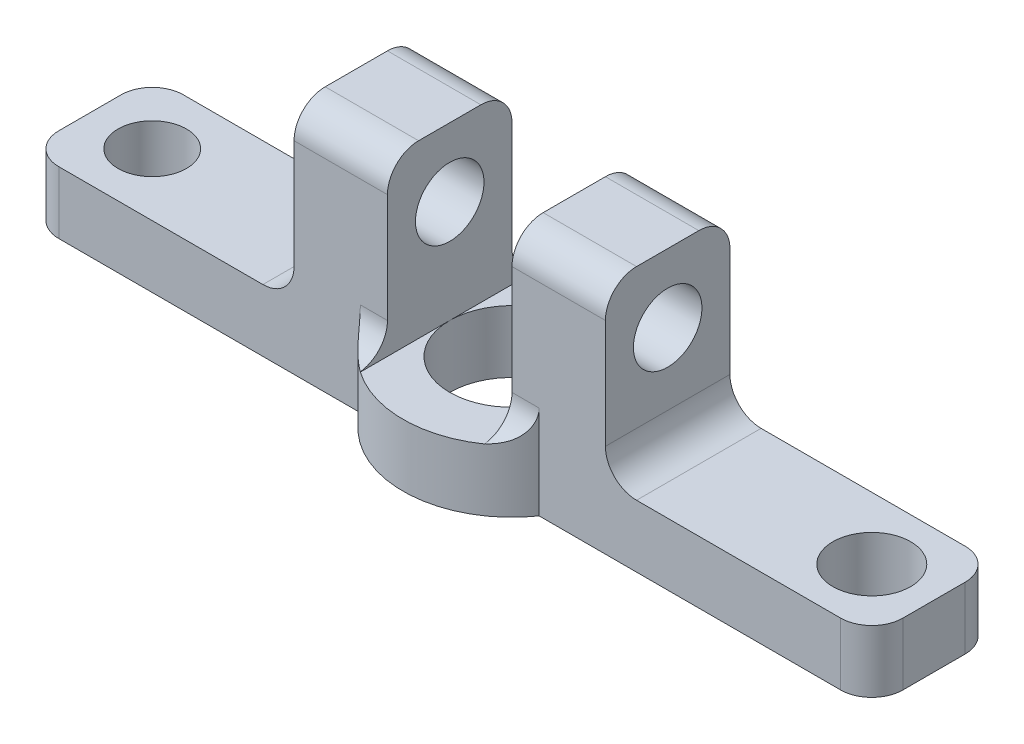
from build123d import *

# Parameters (mm, degrees)
SKETCH_1_R          = 2
SKETCH_1_R_2        = 1.25
SKETCH_1_R_3        = 1.1
EXTRUDE_1_DEPTH     = 2
SKETCH_2_W          = 3
SKETCH_2_H          = 4
EXTRUDE_2_DEPTH     = 5.5
SKETCH_4_R          = 1.1
CUT_EXTRUDE_1_DEPTH = 11
FILLET_2_R          = 1
FILLET_3_R          = 1
FILLET_4_R          = 1
FILLET_5_R          = 1


with BuildPart() as part:
    # 草图1 → 凸台-拉伸1 (new body)
    with BuildSketch(Plane(origin=(0, 0, 0), x_dir=(1, 0, 0), z_dir=(0, 1, 0))):
        with BuildLine():
            Line((6.711295009, -2), (17.394013685, -2))
            Line((17.394013685, -2), (17.394013685, 2))
            Line((17.394013685, 2), (6.711295009, 2))
            ThreePointArc((6.711295009, 2), (3.839013685, 3.5), (0.966732362, 2))
            Line((0.966732362, 2), (-9.715986315, 2))
            Line((-9.715986315, 2), (-9.715986315, -2))
            Line((-9.715986315, -2), (0.966732362, -2))
            ThreePointArc((0.966732362, -2), (3.839013685, -3.5), (6.711295009, -2))
        make_face()
        with Locations(Location((3.839013685, 0, 0), (0, 0, 270))):
            Circle(SKETCH_1_R, mode=Mode.SUBTRACT)
        with Locations(Location((15.394013685, 0, 0), (0, 0, 270))):
            Circle(SKETCH_1_R_2, mode=Mode.SUBTRACT)
        with Locations(Location((-7.715986315, 0, 0), (0, 0, 270))):
            Circle(SKETCH_1_R_3, mode=Mode.SUBTRACT)
    extrude(amount=EXTRUDE_1_DEPTH)

    # 草图2 → 凸台-拉伸2 (add)
    with BuildSketch(Plane(origin=(0, 2, 0), x_dir=(1, 0, 0), z_dir=(0, 1, 0))):
        with Locations((7.339013685, 0)):
            Rectangle(SKETCH_2_W, SKETCH_2_H)
        with Locations((0.339013685, 0)):
            Rectangle(SKETCH_2_W, SKETCH_2_H)
    extrude(amount=EXTRUDE_2_DEPTH)

    # 草图4 → 切除-拉伸1 (cut)
    with BuildSketch(Plane.ZY.offset(1.160986315)):
        with Locations((0, 5.3)):
            Circle(SKETCH_4_R)
    extrude(amount=-CUT_EXTRUDE_1_DEPTH, mode=Mode.SUBTRACT)

    # 圆角2
    fillet_2_edges = [part.edges().sort_by_distance(p)[0] for p in [
        (0.339013685, 7.5, -2),
        (0.339013685, 7.5, 2),
        (7.339013685, 7.5, -2),
        (7.339013685, 7.5, 2),
    ]]
    fillet(fillet_2_edges, radius=FILLET_2_R)

    # 圆角3
    fillet_3_edges = [part.edges().sort_by_distance(p)[0] for p in [
        (-1.160986315, 2, 0),
        (8.839013685, 2, 0),
    ]]
    fillet(fillet_3_edges, radius=FILLET_3_R)

    # 圆角4
    fillet_4_edges = [part.edges().sort_by_distance(p)[0] for p in [
        (-9.715986315, 1, 2),
        (-9.715986315, 1, -2),
        (17.394013685, 1, -2),
        (17.394013685, 1, 2),
    ]]
    fillet(fillet_4_edges, radius=FILLET_4_R)

    # 圆角5
    # the kernel refuses this fillet: 1 mm, written as the material it adds along each edge
    with BuildSketch(Plane(origin=(9.211295009, 2, -2), x_dir=(0, 1, 0), z_dir=(-1, 0, 0))) as fillet_5_piece_1_section:
        with BuildLine():
            CenterArc((FILLET_5_R, FILLET_5_R), FILLET_5_R, 180, 90)
            Line((0, FILLET_5_R), (0, 0))
            Line((0, 0), (FILLET_5_R, 0))
        make_face()
    fillet_5_piece_1 = extrude(amount=3.372281323, mode=Mode.PRIVATE)
    fillet_5_piece_1 = fillet_5_piece_1 & Plane(origin=(3.839013685, 2.261416354, 0), x_dir=(0.820651806648311, 0, -0.571428571428541), z_dir=(0, -1, 0)) * Cylinder(3.5, 11, mode=Mode.PRIVATE)
    add(fillet_5_piece_1)
    with BuildSketch(Plane(origin=(1.839013685, 2, -2), x_dir=(0, 1, 0), z_dir=(-1, 0, 0))) as fillet_5_piece_2_section:
        with BuildLine():
            CenterArc((FILLET_5_R, FILLET_5_R), FILLET_5_R, 180, 90)
            Line((0, FILLET_5_R), (0, 0))
            Line((0, 0), (FILLET_5_R, 0))
        make_face()
    fillet_5_piece_2 = extrude(amount=3.372281323, mode=Mode.PRIVATE)
    fillet_5_piece_2 = fillet_5_piece_2 & Plane(origin=(3.839013685, 2.261416398, 0), x_dir=(0.820651806648311, 0, -0.571428571428541), z_dir=(0, -1, 0)) * Cylinder(3.5, 11, mode=Mode.PRIVATE)
    add(fillet_5_piece_2)
    with BuildSketch(Plane(origin=(-1.533267638, 2, 2), x_dir=(0, 0, 1), z_dir=(1, 0, 0))) as fillet_5_piece_3_section:
        with BuildLine():
            CenterArc((FILLET_5_R, -FILLET_5_R), FILLET_5_R, 90, 90)
            Line((0, -FILLET_5_R), (0, 0))
            Line((0, 0), (FILLET_5_R, 0))
        make_face()
    fillet_5_piece_3 = extrude(amount=3.372281323, mode=Mode.PRIVATE)
    fillet_5_piece_3 = fillet_5_piece_3 & Plane(origin=(3.839013685, 2.26141635, 0), x_dir=(-0.8206518066482962, 0, 0.5714285714285624), z_dir=(0, -1, 0)) * Cylinder(3.5, 11, mode=Mode.PRIVATE)
    add(fillet_5_piece_3)
    with BuildSketch(Plane(origin=(5.839013685, 2, 2), x_dir=(0, 1, 0), z_dir=(1, 0, 0))) as fillet_5_piece_4_section:
        with BuildLine():
            CenterArc((FILLET_5_R, FILLET_5_R), FILLET_5_R, 180, 90)
            Line((0, FILLET_5_R), (0, 0))
            Line((0, 0), (FILLET_5_R, 0))
        make_face()
    fillet_5_piece_4 = extrude(amount=3.372281323, mode=Mode.PRIVATE)
    fillet_5_piece_4 = fillet_5_piece_4 & Plane(origin=(3.839013685, 2.261416398, 0), x_dir=(-0.8206518066482962, 0, 0.5714285714285624), z_dir=(0, -1, 0)) * Cylinder(3.5, 11, mode=Mode.PRIVATE)
    add(fillet_5_piece_4)


solid = part.part
